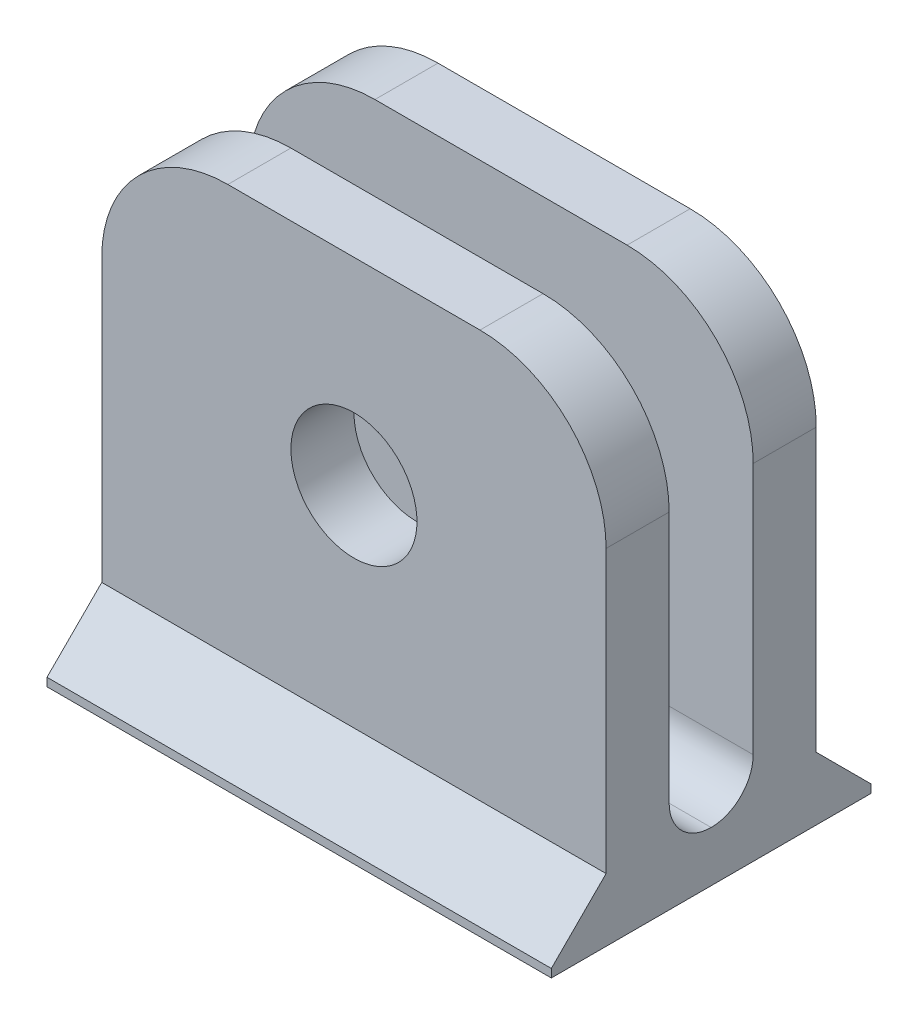
from build123d import *

# Parameters (mm, degrees)
SKETCH1_W           = 12
SKETCH1_H           = 5
BOSS_EXTRUDE1_DEPTH = 1.2
SKETCH2_W           = 12
SKETCH2_H           = 1.5
BOSS_EXTRUDE2_DEPTH = 10
FILLET1_R           = 3
FILLET2_R           = 1
SKETCH3_R           = 1.5
CUT_EXTRUDE1_DEPTH  = 18.159254063
BOSS_EXTRUDE3_DEPTH = 12


with BuildPart() as part:
    # Sketch1 → Boss-Extrude1 (new body)
    with BuildSketch(Plane(origin=(0, 0, 0), x_dir=(1, 0, 0), z_dir=(0, 1, 0))):
        with Locations((6, -2.5)):
            Rectangle(SKETCH1_W, SKETCH1_H)
    extrude(amount=BOSS_EXTRUDE1_DEPTH)

    # Sketch2 → Boss-Extrude2 (add)
    with BuildSketch(Plane(origin=(0, 1.2, 0), x_dir=(1, 0, 0), z_dir=(0, 1, 0))):
        with Locations((6, -4.25)):
            Rectangle(SKETCH2_W, SKETCH2_H)
        with Locations((6, -0.75)):
            Rectangle(SKETCH2_W, SKETCH2_H)
    extrude(amount=BOSS_EXTRUDE2_DEPTH)

    # Fillet1
    fillet1_edges = [part.edges().sort_by_distance(p)[0] for p in [
        (0, 11.2, 4.25),
        (12, 11.2, 4.25),
        (12, 11.2, 0.75),
        (0, 11.2, 0.75),
    ]]
    fillet(fillet1_edges, radius=FILLET1_R)

    # Fillet2
    fillet2_edges = [part.edges().sort_by_distance(p)[0] for p in [
        (6, 1.2, 3.5),
        (6, 1.2, 1.5),
    ]]
    fillet(fillet2_edges, radius=FILLET2_R - 0.0001)  # a hair under: the kernel refuses the full size

    # Sketch3 → Cut-Extrude1 (cut, through all)
    with BuildSketch(Plane(origin=(0, 0, 0), x_dir=(-1, 0, 0), z_dir=(0, 0, -1))):
        with Locations((-6, 6.5)):
            Circle(SKETCH3_R)
    extrude(amount=-CUT_EXTRUDE1_DEPTH, mode=Mode.SUBTRACT)

    # Sketch4 → Boss-Extrude3 (add)
    with BuildSketch(Plane(origin=(12, 0, 0), x_dir=(0, 0, -1), z_dir=(1, 0, 0))):
        Polygon((0, 1.5), (1.303058947, 0.196941053), (1.303058947, 0), (0, 0), align=None)
        Polygon((-6.303058947, 0), (-6.303058947, 0.196941053), (-5, 1.5), (-5, 0), align=None)
    extrude(amount=-BOSS_EXTRUDE3_DEPTH)


solid = part.part
